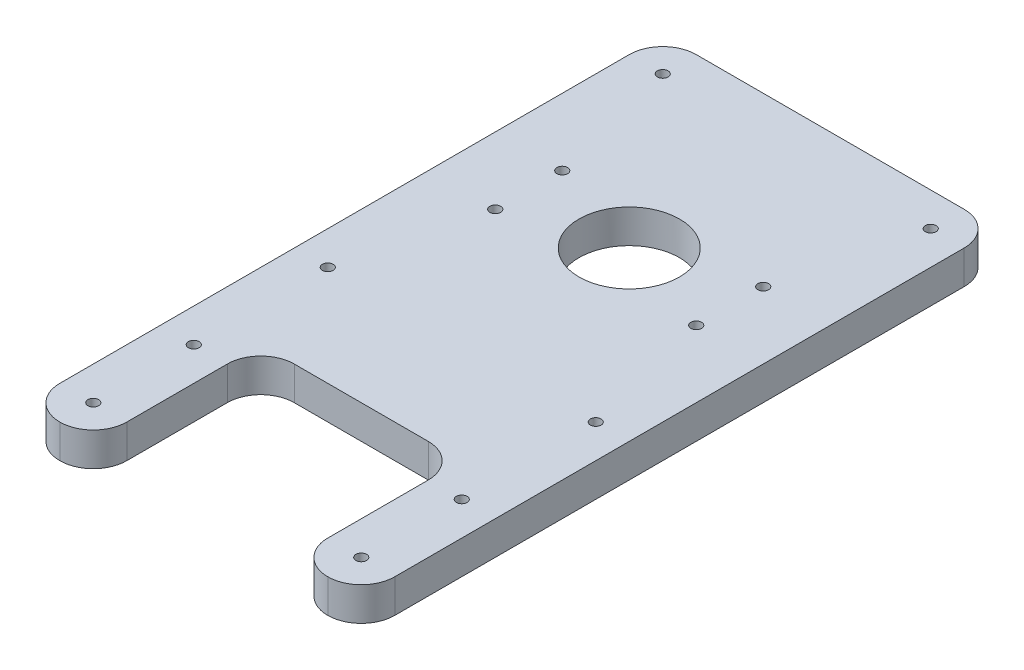
from build123d import *

# Parameters (mm, degrees)
BOSS_EXTRUDE1_DEPTH     = 10
CUT_EXTRUDE1_DEPTH      = 140.642400438
CUT_EXTRUDE1_DEPTH_BACK = 140.642400438
SKETCH2_R               = 15
SKETCH2_R_2             = 1.6
CUT_EXTRUDE2_DEPTH      = 140.642400438
CUT_EXTRUDE2_DEPTH_BACK = 140.642400438
SKETCH3_W               = 60
SKETCH3_H               = 50
CUT_EXTRUDE3_DEPTH      = 140.642400438
CUT_EXTRUDE3_DEPTH_BACK = 140.642400438
SKETCH4_R               = 1.6
FILLET1_R               = 10


with BuildPart() as part:
    # Sketch1 → Boss-Extrude1 (new body)
    with BuildSketch(Plane(origin=(0, 0, 0), x_dir=(1, 0, 0), z_dir=(0, 1, 0))):
        Polygon((-50, -60), (-50, -130), (50, -130), (50, -60), (50, 60), (-50, 60), align=None)
    extrude(amount=BOSS_EXTRUDE1_DEPTH)

    # Sketch2 → Cut-Extrude1 (cut, two sides: drawn at the far end of the back side and taken through both)
    with BuildSketch(Plane(origin=(0, 10, 0), x_dir=(1, 0, 0), z_dir=(0, 1, 0)).offset(-CUT_EXTRUDE1_DEPTH_BACK)):
        with Locations(Location((0, 0, 0), (0, 0, 270))):
            Circle(SKETCH2_R)
        with Locations(Location((-40, -50, 0), (0, 0, 270))):
            Circle(SKETCH2_R_2)
        with Locations(Location((40, -50, 0), (0, 0, 270))):
            Circle(SKETCH2_R_2)
        with Locations(Location((40, 50, 0), (0, 0, 270))):
            Circle(SKETCH2_R_2)
        with Locations(Location((-40, 50, 0), (0, 0, 270))):
            Circle(SKETCH2_R_2)
        with Locations(Location((-40, -120, 0), (0, 0, 270))):
            Circle(SKETCH2_R_2)
        with Locations(Location((40, -120, 0), (0, 0, 270))):
            Circle(SKETCH2_R_2)
        with Locations(Location((-40, -90, 0), (0, 0, 270))):
            Circle(SKETCH2_R_2)
        with Locations(Location((40, -90, 0), (0, 0, 270))):
            Circle(SKETCH2_R_2)
    extrude(amount=CUT_EXTRUDE1_DEPTH + CUT_EXTRUDE1_DEPTH_BACK, mode=Mode.SUBTRACT)

    # Sketch3 → Cut-Extrude2 (cut, two sides: drawn at the far end of the back side and taken through both)
    with BuildSketch(Plane(origin=(0, 10, 0), x_dir=(1, 0, 0), z_dir=(0, 1, 0)).offset(-CUT_EXTRUDE2_DEPTH_BACK)):
        with Locations((0, -105)):
            Rectangle(SKETCH3_W, SKETCH3_H)
    extrude(amount=CUT_EXTRUDE2_DEPTH + CUT_EXTRUDE2_DEPTH_BACK, mode=Mode.SUBTRACT)

    # Sketch4 → Cut-Extrude3 (cut, two sides: drawn at the far end of the back side and taken through both)
    with BuildSketch(Plane(origin=(0, 10, 0), x_dir=(1, 0, 0), z_dir=(0, 1, 0)).offset(-CUT_EXTRUDE3_DEPTH_BACK)):
        with Locations(Location((-30, 10, 0), (0, 0, 270))):
            Circle(SKETCH4_R)
        with Locations(Location((-30, -10, 0), (0, 0, 270))):
            Circle(SKETCH4_R)
        with Locations(Location((30, 10, 0), (0, 0, 270))):
            Circle(SKETCH4_R)
        with Locations(Location((30, -10, 0), (0, 0, 270))):
            Circle(SKETCH4_R)
    extrude(amount=CUT_EXTRUDE3_DEPTH + CUT_EXTRUDE3_DEPTH_BACK, mode=Mode.SUBTRACT)

    # Fillet1
    fillet1_edges = [part.edges().sort_by_distance(p)[0] for p in [
        (50, 5, -60),
        (-50, 5, -60),
        (-50, 5, 130),
        (-30, 5, 130),
        (50, 5, 130),
        (30, 5, 130),
        (30, 5, 80),
        (-30, 5, 80),
    ]]
    fillet(fillet1_edges, radius=FILLET1_R - 0.0001)  # a hair under: the kernel refuses the full size


solid = part.part
